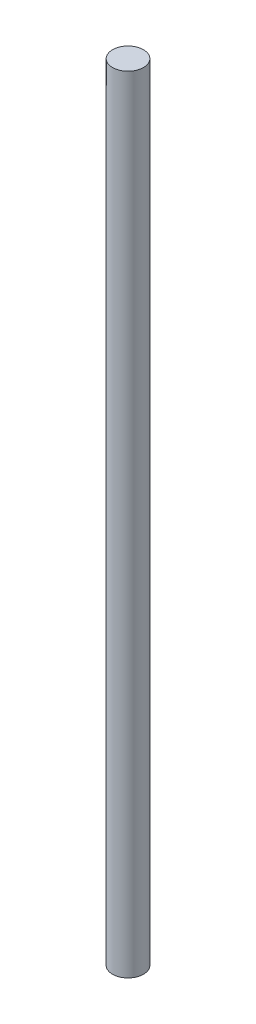
from build123d import *

# Parameters (mm, degrees)
SKETCH1_R           = 6
BOSS_EXTRUDE1_DEPTH = 304.8


with BuildPart() as part:
    # Sketch1 → Boss-Extrude1 (new body)
    with BuildSketch(Plane(origin=(0, 0, 0), x_dir=(1, 0, 0), z_dir=(0, 1, 0))):
        Circle(SKETCH1_R)
    extrude(amount=BOSS_EXTRUDE1_DEPTH)


solid = part.part
